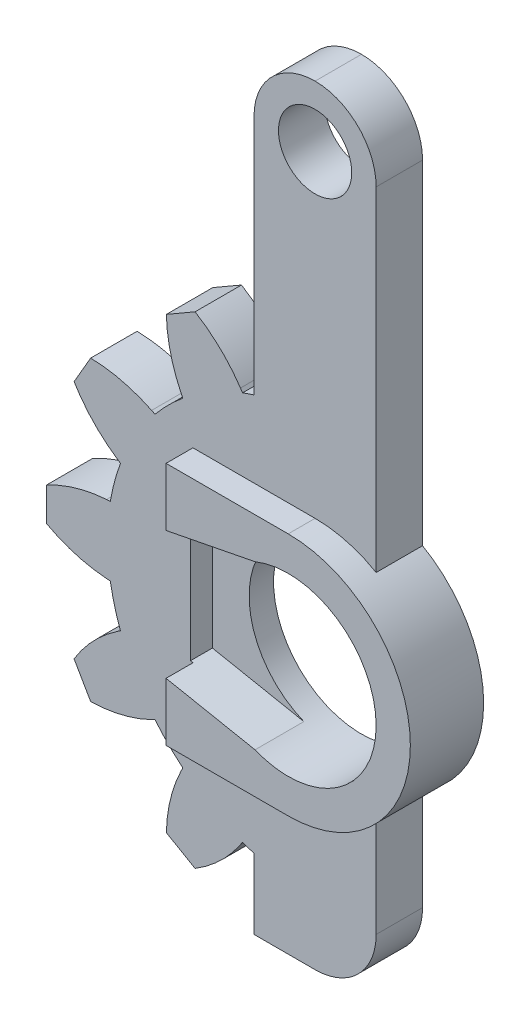
from build123d import *

# Parameters (mm, degrees)
SKETCH1_R           = 8.5
BOSS_EXTRUDE1_DEPTH = 1.9
BOSS_EXTRUDE2_DEPTH = 1.9
CIRPATTERN2_COUNT   = 12
FILLET5_R           = 6
FILLET6_R           = 6
BOSS_EXTRUDE3_DEPTH = 1.9
SKETCH6_W           = 11.017873235
SKETCH6_H           = 24.192230011
CUT_EXTRUDE2_DEPTH  = 24.342236397
SKETCH8_R           = 5
BOSS_EXTRUDE4_DEPTH = 3
SKETCH14_W          = 5
SKETCH14_H          = 10
BOSS_EXTRUDE8_DEPTH = 3
SKETCH17_R          = 1.5
CUT_EXTRUDE10_DEPTH = 24.342236397
FILLET9_R           = 2.5
FILLET10_R          = 2.5
CUT_EXTRUDE11_DEPTH = 2
SKETCH20_R          = 3.6
CUT_EXTRUDE12_DEPTH = 24.457408211


# Some blends are built 0.0001 mm under size
with BuildPart() as part:
    # Sketch1 → Boss-Extrude1 (new body)
    with BuildSketch(Plane.XY):
        with Locations(Location((0, 0, 0), (0, 0, 180))):
            Circle(SKETCH1_R)
    extrude(amount=BOSS_EXTRUDE1_DEPTH)

    # Sketch3 → Boss-Extrude2 (add)
    with BuildSketch(Plane.XY.offset(1.9)):
        Polygon((-1.305261922, 9.914448614), (-1.509060022, 7), (1.509060022, 7), (1.305261922, 9.914448614), (0.678518537, 11), (-0.678518537, 11), align=None)
    boss_extrude2 = extrude(amount=-BOSS_EXTRUDE2_DEPTH)

    # CirPattern2: Boss-Extrude2 ×12 about axis
    cirpattern2_axis = Axis((0, 0, 0), (0, 0, 1))
    for i in range(1, CIRPATTERN2_COUNT):
        add(boss_extrude2.rotate(cirpattern2_axis, i * 360 / CIRPATTERN2_COUNT))

    # Fillet5
    # the kernel refuses this fillet: 6 mm, written as the material it takes off along each edge
    with BuildSketch(Plane(origin=(9.238795325, 3.826834324, 5.354382408), x_dir=(0.49999999999981276, 0.8660254037845467, 0), z_dir=(0, 0, -1)), Plane(origin=(1.305261922, 9.914448614, 5.354382408), x_dir=(-0.5000000000001841, 0.8660254037843323, 0), z_dir=(0, 0, -1)), Plane(origin=(-7.933533403, 6.08761429, 5.354382408), x_dir=(-1, 0, 0), z_dir=(0, 0, -1)), Plane(origin=(-9.914448614, 1.305261922, 5.354382408), x_dir=(-0.8660254037843321, -0.5000000000001844, 0), z_dir=(0, 0, -1)), Plane(origin=(-9.238795325, -3.826834324, 5.354382408), x_dir=(-0.49999999999981826, -0.8660254037845436, 0), z_dir=(0, 0, -1)), Plane(origin=(-6.08761429, -7.933533403, 5.354382408), x_dir=(0, -1, 0), z_dir=(0, 0, -1)), Plane(origin=(3.826834324, -9.238795325, 5.354382408), x_dir=(0.8660254037845474, -0.49999999999981154, 0), z_dir=(0, 0, -1)), Plane(origin=(7.933533403, -6.08761429, 5.354382408), x_dir=(1, 0, 0), z_dir=(0, 0, -1)), Plane(origin=(9.914448614, -1.305261922, 5.354382408), x_dir=(0.866025403784333, 0.500000000000183, 0), z_dir=(0, 0, -1))) as fillet5_piece_1:
        with BuildLine():
            CenterArc((1.388315544, -5.998484909), FILLET5_R, 91.287628333, 24.712371667)
            Line((-1.241911337, -0.605720631), (-1.294515874, -0.497865346))
            Line((-1.294515874, -0.497865346), (-0.052604538, 0.107855286))
            Line((-0.052604538, 0.107855286), (0, 0.12))
            ThreePointArc((0, 0.12), (0.626743385, 0.12), (1.250790195, 0.119969698))
            Line((1.250790195, 0.119969698), (1.25348677, 0))
        make_face()
    extrude(amount=8.808764816, mode=Mode.SUBTRACT)
    with BuildSketch(Plane(origin=(6.08761429, 7.933533403, 5.354382408), x_dir=(-0.4383711467890806, -0.8987940462991654, 0), z_dir=(0, 0, -1)), Plane(origin=(-3.826834324, 9.238795325, 5.354382408), x_dir=(0.5591929034707432, -0.8290375725550441, 0), z_dir=(0, 0, -1)), Plane(origin=(-1.305261922, -9.914448614, 5.354382408), x_dir=(-0.06975647374412203, 0.9975640502598244, 0), z_dir=(0, 0, -1))) as fillet5_piece_2:
        with BuildLine():
            CenterArc((1.381752963, 6), FILLET5_R, 245.287628333, 24.712371667)
            Line((-1.126626446, 0.549492433), (-1.176794034, 0.440482282))
            ThreePointArc((-1.176794034, 0.440482282), (-0.615917761, 0.166890931), (-0.052604538, -0.107855286))
            Line((-0.052604538, -0.107855286), (0, -0.12))
            Line((0, -0.12), (1.381752963, -0.12))
            Line((1.381752963, -0.12), (1.381752963, 0))
        make_face()
    extrude(amount=8.808764816, mode=Mode.SUBTRACT)

    # Fillet6
    # the kernel refuses this fillet: 6 mm, written as the material it takes off along each edge
    with BuildSketch(Plane(origin=(7.933533403, 6.08761429, 5.354382408), x_dir=(-0.8987940462991681, -0.4383711467890751, 0), z_dir=(0, 0, -1)), Plane(origin=(3.826834324, 9.238795325, 5.354382408), x_dir=(-0.5591929034707512, -0.8290375725550386, 0), z_dir=(0, 0, -1)), Plane(origin=(-1.305261922, 9.914448614, 5.354382408), x_dir=(-0.06975647374412959, -0.9975640502598239, 0), z_dir=(0, 0, -1)), Plane(origin=(-6.08761429, 7.933533403, 5.354382408), x_dir=(0.43837114678907496, -0.8987940462991681, 0), z_dir=(0, 0, -1)), Plane(origin=(-9.238795325, 3.826834324, 5.354382408), x_dir=(0.8290375725550395, -0.5591929034707501, 0), z_dir=(0, 0, -1)), Plane(origin=(-9.914448614, -1.305261922, 5.354382408), x_dir=(0.9975640502598241, -0.0697564737441288, 0), z_dir=(0, 0, -1)), Plane(origin=(-7.933533403, -6.08761429, 5.354382408), x_dir=(0.8987940462991686, 0.4383711467890744, 0), z_dir=(0, 0, -1)), Plane(origin=(-3.826834324, -9.238795325, 5.354382408), x_dir=(0.5591929034707488, 0.8290375725550403, 0), z_dir=(0, 0, -1)), Plane(origin=(1.305261922, -9.914448614, 5.354382408), x_dir=(0.06975647374412966, 0.9975640502598239, 0), z_dir=(0, 0, -1)), Plane(origin=(6.08761429, -7.933533403, 5.354382408), x_dir=(-0.4383711467890749, 0.8987940462991683, 0), z_dir=(0, 0, -1)), Plane(origin=(9.238795325, -3.826834324, 5.354382408), x_dir=(-0.8290375725550393, 0.5591929034707505, 0), z_dir=(0, 0, -1)), Plane(origin=(9.914448614, 1.305261922, 5.354382408), x_dir=(-0.9975640502598239, 0.06975647374412894, 0), z_dir=(0, 0, -1))) as fillet6_piece_1:
        with BuildLine():
            CenterArc((1.381752963, -6), FILLET6_R, 90, 24.712371667)
            Line((-1.126626446, -0.549492433), (-1.176794034, -0.440482282))
            ThreePointArc((-1.176794034, -0.440482282), (-0.615917761, -0.166890931), (-0.052604538, 0.107855286))
            Line((-0.052604538, 0.107855286), (0, 0.12))
            Line((0, 0.12), (1.381752963, 0.12))
            Line((1.381752963, 0.12), (1.381752963, 0))
        make_face()
    extrude(amount=8.808764816, mode=Mode.SUBTRACT)

    # Sketch4 → Boss-Extrude3 (add)
    with BuildSketch(Plane(origin=(0, 0, 0), x_dir=(-1, 0, 0), z_dir=(0, 0, -1))):
        with BuildLine():
            Line((-2.5, 20.5), (-2.5, 4.330127019))
            ThreePointArc((-2.5, 4.330127019), (-5, 0), (-2.5, -4.330127019))
            Line((-2.5, -4.330127019), (-2.5, -11))
            Line((-2.5, -11), (2.5, -11))
            Line((2.5, -11), (2.5, -4.330127019))
            ThreePointArc((2.5, -4.330127019), (5, 0), (2.5, 4.330127019))
            Line((2.5, 4.330127019), (2.5, 20.5))
            Line((2.5, 20.5), (-2.5, 20.5))
        make_face()
    extrude(amount=-BOSS_EXTRUDE3_DEPTH)

    # Sketch6 → Cut-Extrude2 (cut, through all)
    with BuildSketch(Plane(origin=(0, 0, 0), x_dir=(-1, 0, 0), z_dir=(0, 0, -1))):
        with Locations((-8.008936618, 1.096115006)):
            Rectangle(SKETCH6_W, SKETCH6_H)
    extrude(amount=-CUT_EXTRUDE2_DEPTH, mode=Mode.SUBTRACT)

    # Sketch8 → Boss-Extrude4 (add)
    with BuildSketch(Plane(origin=(0, 0, 0), x_dir=(-1, 0, 0), z_dir=(0, 0, -1))):
        Circle(SKETCH8_R)
    extrude(amount=-BOSS_EXTRUDE4_DEPTH)

    # Sketch14 → Boss-Extrude8 (add)
    with BuildSketch(Plane(origin=(0, 0, 0), x_dir=(-1, 0, 0), z_dir=(0, 0, -1))):
        with Locations((2.5, 0)):
            Rectangle(SKETCH14_W, SKETCH14_H)
    extrude(amount=-BOSS_EXTRUDE8_DEPTH)

    # Sketch17 → Cut-Extrude10 (cut, through all)
    with BuildSketch(Plane.XY.offset(1.9)):
        with Locations((0, 18)):
            Circle(SKETCH17_R)
    extrude(amount=-CUT_EXTRUDE10_DEPTH, mode=Mode.SUBTRACT)

    # Fillet9
    fillet9_edges = [part.edges().sort_by_distance(p)[0] for p in [
        (-2.5, 20.5, 0.95),
        (2.5, 20.5, 0.95),
    ]]
    fillet(fillet9_edges, radius=FILLET9_R - 0.0001)  # a hair under: the kernel refuses the full size

    # Fillet10
    fillet10_edges = [part.edges().sort_by_distance(p)[0] for p in [
        (2.5, -11, 0.95),
    ]]
    fillet(fillet10_edges, radius=FILLET10_R)

    # Sketch19 → Cut-Extrude11 (cut)
    with BuildSketch(Plane.XY.offset(3)):
        Polygon((0, 3.6), (-5.102940329, 2.6), (-5.102940329, -2.6), (0, -3.6), align=None)
    extrude(amount=-CUT_EXTRUDE11_DEPTH, mode=Mode.SUBTRACT)

    # Sketch20 → Cut-Extrude12 (cut, through all)
    with BuildSketch(Plane.XY.offset(3)):
        Circle(SKETCH20_R)
    extrude(amount=-CUT_EXTRUDE12_DEPTH, mode=Mode.SUBTRACT)


solid = part.part
